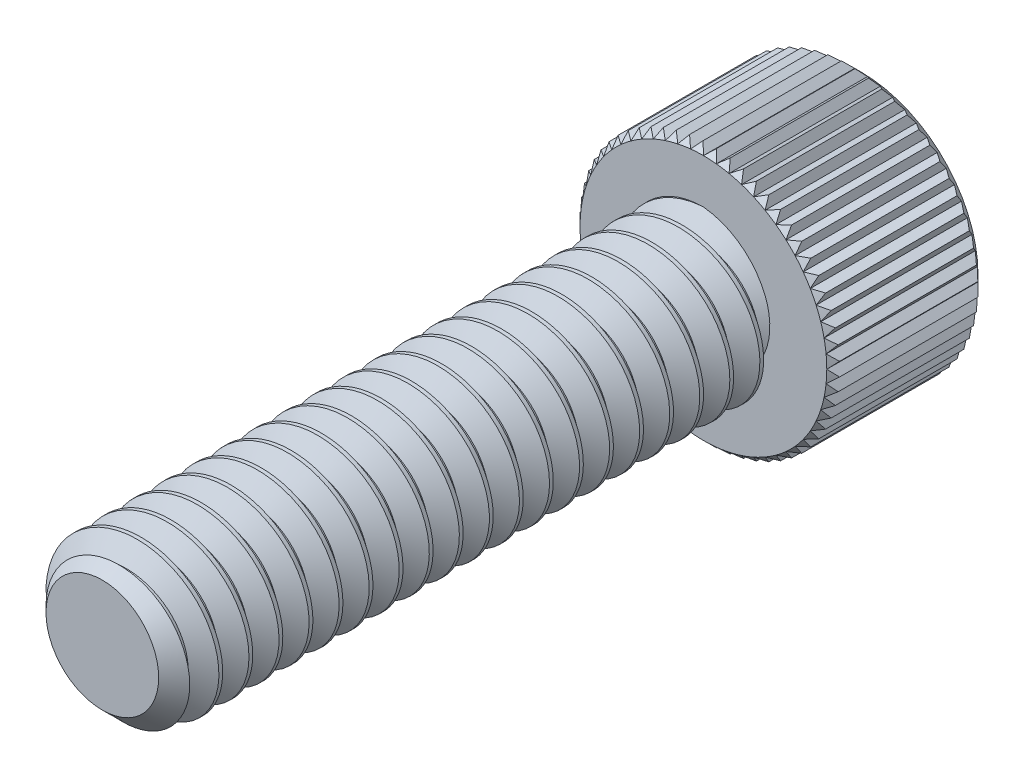
from build123d import *
from build123d.topology import SkipClean

# Parameters (mm, degrees)
SKETCH1_R          = 2.0828
EXTRUDE1_DEPTH     = 15.875
CHAMFER3_SIZE      = 0.5953125
CUT_SWEEP1_PITCH   = 0.79375
SKETCH6_R          = 3.429
EXTRUDE2_DEPTH     = 4.1656
CUT_EXTRUDE1_DEPTH = 2.67890625
CHAMFER1_SIZE      = 0.3429
CHAMFER2_SIZE      = 0.17145
CUT_EXTRUDE3_DEPTH = 17.599147875
CIRPATTERN1_COUNT  = 60


with BuildPart() as part:
    # Sketch1 → Extrude1 (new body)
    with BuildSketch(Plane.XY):
        Circle(SKETCH1_R)
    extrude(amount=-EXTRUDE1_DEPTH)

    # Chamfer3
    chamfer3_edges = [part.edges().sort_by_distance(p)[0] for p in [
        (-2.0828, 0, 0),
    ]]
    chamfer(chamfer3_edges, length=CHAMFER3_SIZE)

    # Cut-Sweep1: the profile of Sketch3 profile screwed along a right-hand helix of 21 turns, 6 arcs to a turn; built about Z, then put on its axis
    cut_sweep1_z = Axis((0, 0, 0), (0, 0, 1))
    cut_sweep1_corners = [(2.0831, 0, -0.694704455), (1.567244252, 0, -0.396875), (1.567244252, 0, -0.29765625), (2.0831, 0, 0.000173205)]
    with BuildLine(mode=Mode.PRIVATE) as cut_sweep1_profile:
        Line(cut_sweep1_corners[0], cut_sweep1_corners[1])
        Line(cut_sweep1_corners[1], cut_sweep1_corners[2])
        Line(cut_sweep1_corners[2], cut_sweep1_corners[3])
        Line(cut_sweep1_corners[3], cut_sweep1_corners[0])
    cut_sweep1_cap = Face(cut_sweep1_profile.wire())
    cut_sweep1_turn_angles = [0, 30, 60, 90, 120, 150, 180, 210, 240, 270, 300, 330, 360]
    cut_sweep1_turn_weights = [1, 0.8660254037844387, 1, 0.8660254037844387, 1, 0.8660254037844387, 1, 0.8660254037844387, 1, 0.8660254037844387, 1, 0.8660254037844387, 1]
    cut_sweep1_turn_rails = [Edge.make_bspline([Vector(p[0], p[1], 0).rotate(cut_sweep1_z, cut_sweep1_turn_angles[k]) / cut_sweep1_turn_weights[k] + Vector(0, 0, p[2] + CUT_SWEEP1_PITCH * cut_sweep1_turn_angles[k] / 360) for k in range(13)], [0, 0, 0, 1, 1, 2, 2, 3, 3, 4, 4, 5, 5, 6, 6, 6], 2, cut_sweep1_turn_weights) for p in cut_sweep1_corners]
    cut_sweep1_turn_sides = [Face.make_surface_from_curves(cut_sweep1_turn_rails[p[0]], cut_sweep1_turn_rails[p[1]]) for p in [(0, 1), (1, 2), (2, 3), (3, 0)]]
    cut_sweep1 = Plane(origin=(0, 0, 0), x_dir=(0, 1, 0), z_dir=(0, 0, -1)) * Solid(Shell([*[p.moved(Location((0, 0, CUT_SWEEP1_PITCH * i))) for i in range(21) for p in cut_sweep1_turn_sides], cut_sweep1_cap, cut_sweep1_cap.rotate(cut_sweep1_z, 7560).moved(Location((0, 0, CUT_SWEEP1_PITCH * 7560 / 360)))]))
    add(cut_sweep1, mode=Mode.SUBTRACT)

    # Sketch6 → Extrude2 (add)
    with BuildSketch(Plane(origin=(0, 0, -15.875), x_dir=(-1, 0, 0), z_dir=(0, 0, -1))):
        Circle(SKETCH6_R)
    extrude(amount=EXTRUDE2_DEPTH)

    # Sketch7 → Cut-Extrude1 (cut)
    with BuildSketch(Plane(origin=(0, 0, -20.0406), x_dir=(-1, 0, 0), z_dir=(0, 0, -1))):
        Polygon((0, 2.062222993), (-1.7859375, 1.031111496), (-1.7859375, -1.031111496), (0, -2.062222993), (1.7859375, -1.031111496), (1.7859375, 1.031111496), align=None)
    extrude(amount=-CUT_EXTRUDE1_DEPTH, mode=Mode.SUBTRACT)

    # Cut-Extrude2 cone 1 section (through the dimple's axis) → Cut-Extrude2 (revolve, cut)
    with BuildSketch(Plane(origin=(0, 0, -20.0406), x_dir=(0, 1, 0), z_dir=(1, 0, 0))):
        Polygon((0, 0), (2.062222993, 0), (0, 2.062222993), align=None)
    revolve(axis=Axis((0, 0, -20.0406), (0, 0, 1)), mode=Mode.SUBTRACT)

    # Chamfer1
    chamfer1_edges = [part.edges().sort_by_distance(p)[0] for p in [
        (3.429, 0, -20.0406),
    ]]
    chamfer(chamfer1_edges, length=CHAMFER1_SIZE)

    # Chamfer2
    chamfer2_edges = [part.edges().sort_by_distance(p)[0] for p in [
        (3.429, 0, -15.875),
    ]]
    chamfer(chamfer2_edges, length=CHAMFER2_SIZE)

    # Sketch10 → Cut-Extrude3 (cut, through all)
    with SkipClean():  # the faces are left unmerged after this step: merging them gives an invalid solid
        with BuildSketch(Plane.XY.offset(-15.875)):
            Polygon((-0.36903498, 3.60045), (0, 3.25755), (0.36903498, 3.60045), align=None)
        cut_extrude3 = extrude(amount=-CUT_EXTRUDE3_DEPTH, mode=Mode.SUBTRACT)

    # CirPattern1: Cut-Extrude3 ×60 about axis
    cirpattern1_axis = Axis((0, 0, 0), (0, 0, 1))
    for i in range(1, CIRPATTERN1_COUNT):
        add(cut_extrude3.rotate(cirpattern1_axis, i * 360 / CIRPATTERN1_COUNT), mode=Mode.SUBTRACT)


solid = part.part
